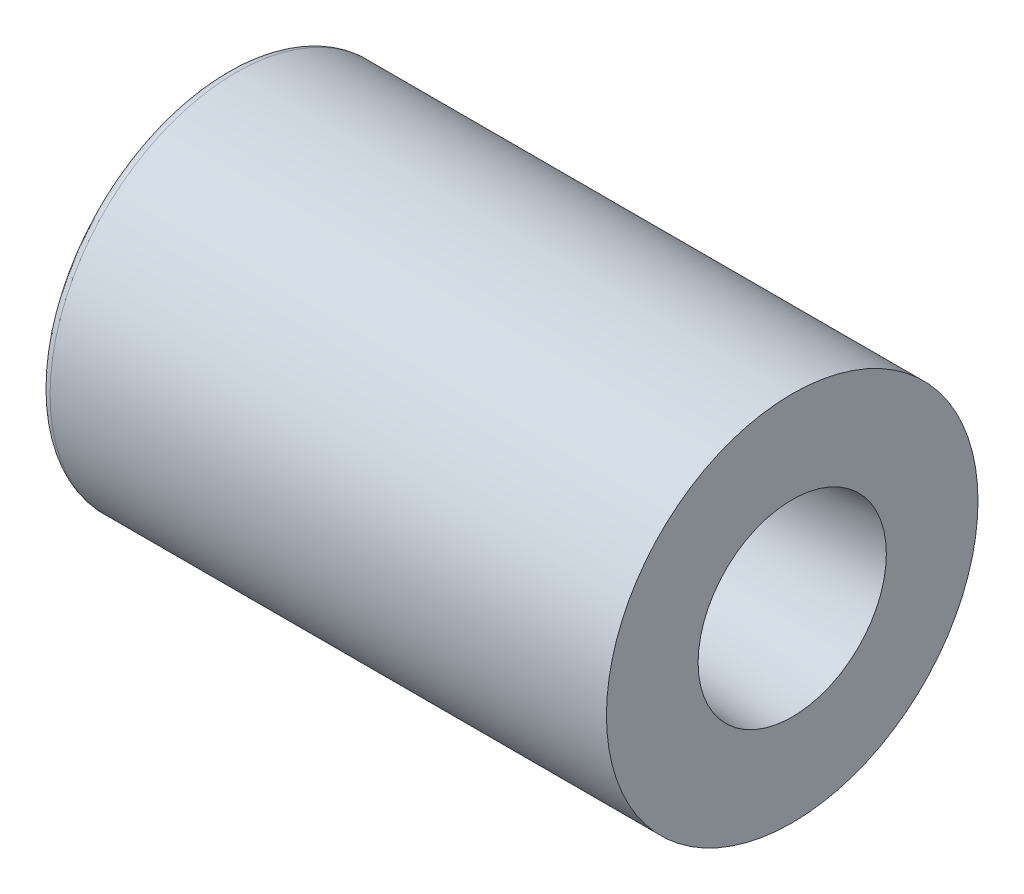
from build123d import *

# Parameters (mm, degrees)
FILLET1_R = 0.508


with BuildPart() as part:
    # Sketch1 → Revolve1 (revolve)
    with BuildSketch(Plane(origin=(0, 0, 0), x_dir=(1, 0, 0), z_dir=(0, 1, 0))):
        Polygon((0, 2.286), (0, 5.3848), (1.905, 5.3848), (1.905, 8.001), (0, 8.001), (0, 9.525), (29.032332849, 9.525), (29.032332849, 4.826), align=None)
    revolve(axis=Axis((0, 0, 0), (1, 0, 0)))

    # Fillet1
    fillet1_edges = [part.edges().sort_by_distance(p)[0] for p in [
        (0, 0, 9.525),
    ]]
    fillet(fillet1_edges, radius=FILLET1_R)


solid = part.part
